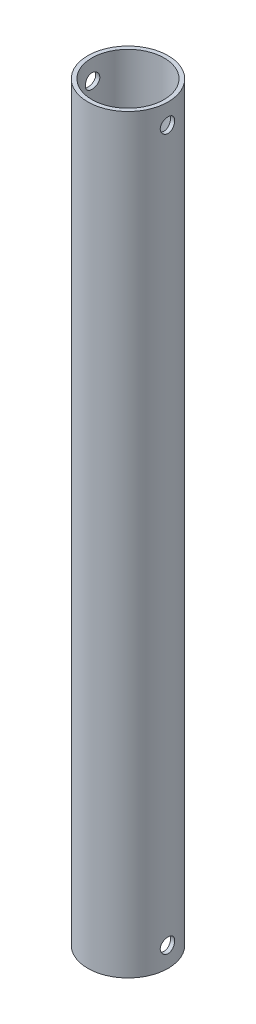
from build123d import *

# Parameters (mm, degrees)
SKETCH1_R            = 10
SKETCH1_R_2          = 9
BOSS_EXTRUDE1_DEPTH  = 187
M3_CLEARANCE_HOLE1_D = 3.6


with BuildPart() as part:
    # Sketch1 → Boss-Extrude1 (new body)
    with BuildSketch(Plane(origin=(0, 0, 0), x_dir=(1, 0, 0), z_dir=(0, 1, 0))):
        Circle(SKETCH1_R)
        Circle(SKETCH1_R_2, mode=Mode.SUBTRACT)
    extrude(amount=BOSS_EXTRUDE1_DEPTH)

    # M3 Clearance Hole1 (through all)
    with Locations(Plane(origin=(10, 0, 0), x_dir=(0, 0, -1), z_dir=(1, 0, 0))):
        with Locations((0, 5)):
            m3_clearance_hole1 = Hole(M3_CLEARANCE_HOLE1_D / 2)

    # Mirror1: M3 Clearance Hole1 across plane
    add(m3_clearance_hole1.mirror(Plane.ZX.offset(93.5)), mode=Mode.SUBTRACT)


solid = part.part
